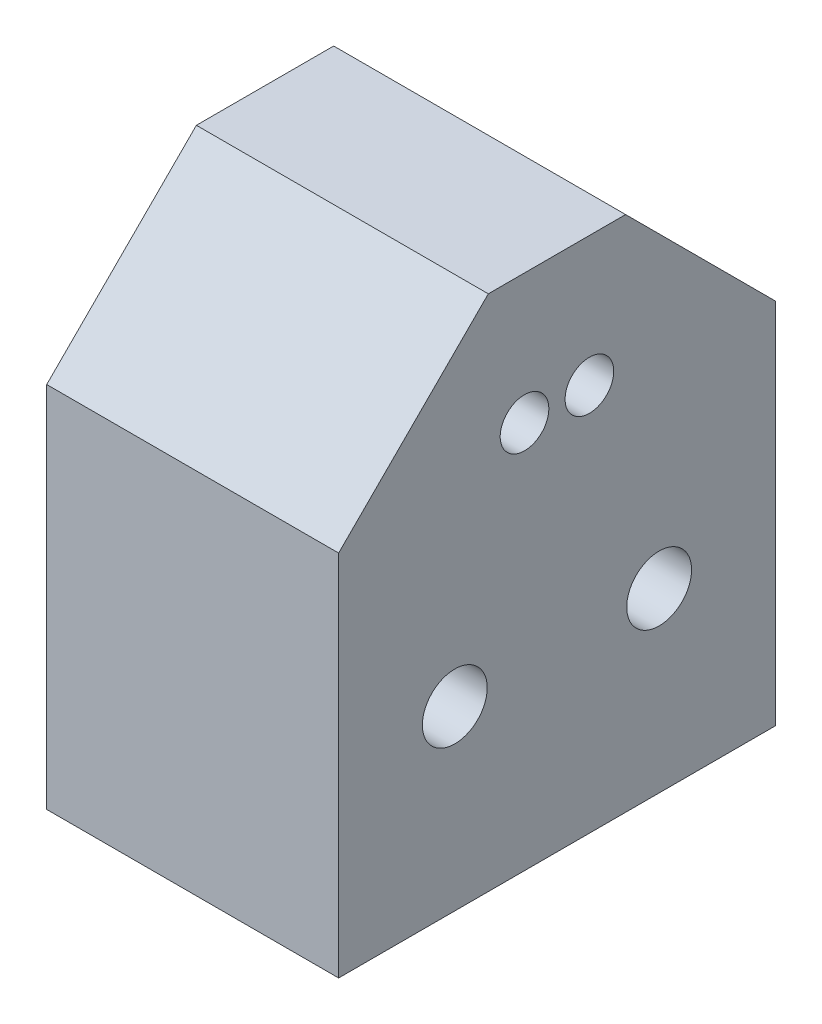
from build123d import *

# Parameters (mm, degrees)
BOSS_EXTRUDE1_DEPTH = 18
SKETCH2_R           = 1.5
SKETCH2_R_2         = 2
CUT_EXTRUDE2_DEPTH  = 53.087467567


with BuildPart() as part:
    # Sketch1 → Boss-Extrude1 (new body)
    with BuildSketch(Plane(origin=(0, 0, 0), x_dir=(0, 0, -1), z_dir=(1, 0, 0))):
        Polygon((-19.081516646, 35.771524569), (-9.853041216, 45), (-1.386641074, 45), (7.841834357, 35.771524569), (7.841834357, 13.079888612), (-19.081516646, 13.079888612), align=None)
    extrude(amount=BOSS_EXTRUDE1_DEPTH)

    # Sketch2 → Cut-Extrude2 (cut, through all)
    with BuildSketch(Plane(origin=(18, 0, 0), x_dir=(0, 0, -1), z_dir=(1, 0, 0))):
        with Locations((-7.619841145, 37)):
            Circle(SKETCH2_R)
        with Locations((-3.619841145, 37)):
            Circle(SKETCH2_R)
        with Locations((-11.919841145, 24)):
            Circle(SKETCH2_R_2)
        with Locations((0.680158855, 24)):
            Circle(SKETCH2_R_2)
    extrude(amount=-CUT_EXTRUDE2_DEPTH, mode=Mode.SUBTRACT)


solid = part.part
